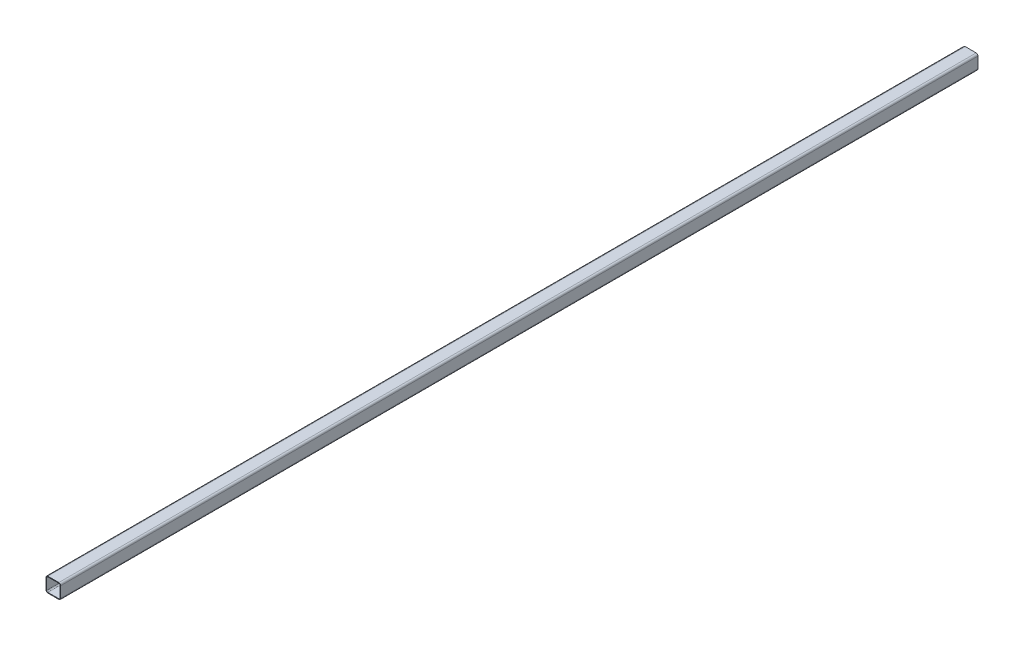
from build123d import *

# Parameters (mm, degrees)
BOSS_EXTRUDE1_DEPTH      = 500
BOSS_EXTRUDE1_DEPTH_BACK = 500


with BuildPart() as part:
    # Sketch1 → Boss-Extrude1 (new, two sides: drawn at the far end of the back side and taken through both)
    with BuildSketch(Plane.XY.offset(-BOSS_EXTRUDE1_DEPTH_BACK)):
        with BuildLine():
            Line((-6, -8), (6, -8))
            ThreePointArc((6, -8), (7.414213562, -7.414213562), (8, -6))
            Line((8, -6), (8, 6))
            ThreePointArc((8, 6), (7.414213562, 7.414213562), (6, 8))
            Line((6, 8), (-6, 8))
            ThreePointArc((-6, 8), (-7.414213562, 7.414213562), (-8, 6))
            Line((-8, 6), (-8, -6))
            ThreePointArc((-8, -6), (-7.414213562, -7.414213562), (-6, -8))
        make_face()
        with BuildLine():
            Line((-6, 7.32), (6, 7.32))
            ThreePointArc((6, 7.32), (6.933380951, 6.933380951), (7.32, 6))
            Line((7.32, 6), (7.32, -6))
            ThreePointArc((7.32, -6), (6.933380951, -6.933380951), (6, -7.32))
            Line((6, -7.32), (-6, -7.32))
            ThreePointArc((-6, -7.32), (-6.933380951, -6.933380951), (-7.32, -6))
            Line((-7.32, -6), (-7.32, 6))
            ThreePointArc((-7.32, 6), (-6.933380951, 6.933380951), (-6, 7.32))
        make_face(mode=Mode.SUBTRACT)
    extrude(amount=BOSS_EXTRUDE1_DEPTH + BOSS_EXTRUDE1_DEPTH_BACK)


solid = part.part
